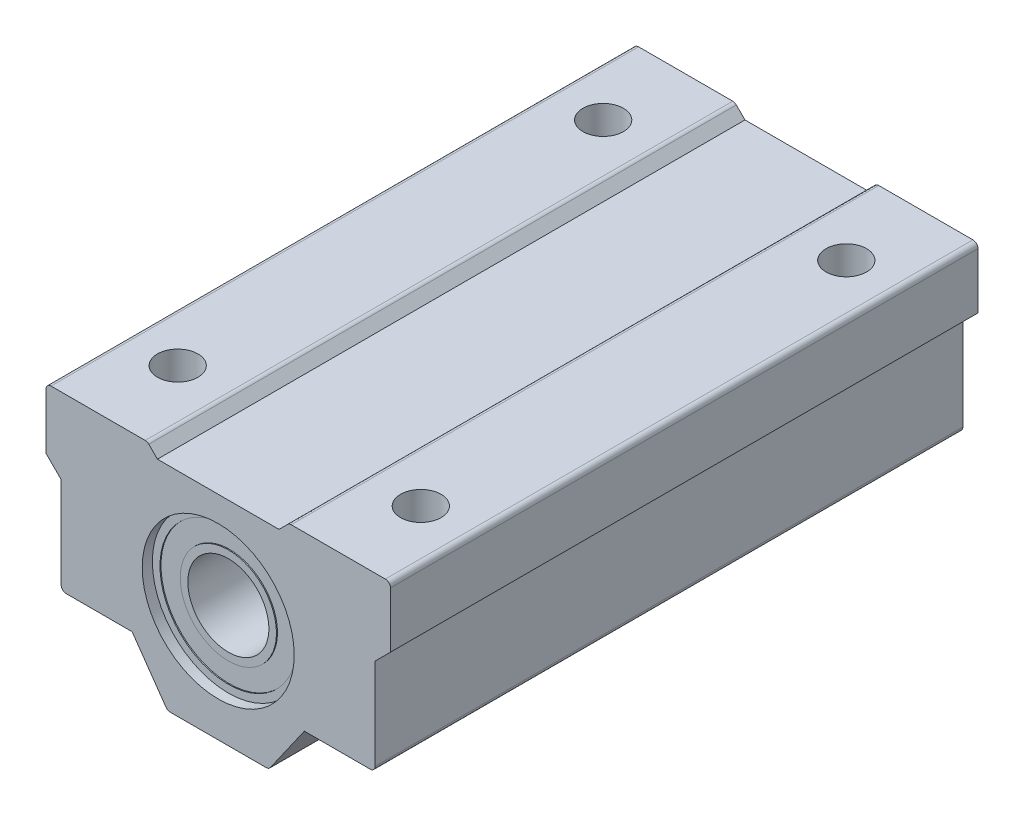
from build123d import *

# Parameters (mm, degrees)
SKETCH1_W           = 31
SKETCH1_H           = 16
BOSS_EXTRUDE1_DEPTH = 58
SKETCH2_W           = 17
SKETCH2_H           = 21
BOSS_EXTRUDE2_DEPTH = 58
SKETCH3_W           = 10
SKETCH3_H           = 6
BOSS_EXTRUDE3_DEPTH = 58
CHAMFER1_SIZE       = 1
CHAMFER2_SIZE       = 1.5
CHAMFER5_SIZE2      = 3.501037691
CHAMFER5_SIZE       = 5
CHAMFER6_SIZE2      = 5
CHAMFER6_SIZE       = 3.501037691
SKETCH4_R           = 7.5
CUT_EXTRUDE1_DEPTH  = 1
CUT_EXTRUDE2_START  = -1
SKETCH5_R           = 7.5
CUT_EXTRUDE2_DEPTH  = 1
SKETCH6_R           = 4
CUT_EXTRUDE3_DEPTH  = 58
SKETCH7_R           = 2
CUT_EXTRUDE4_DEPTH  = 20
SKETCH8_R           = 6.75
SKETCH8_R_2         = 4.75
CUT_EXTRUDE5_DEPTH  = 0.1
CUT_EXTRUDE6_START  = -0.1
SKETCH9_R           = 6.75
SKETCH9_R_2         = 4.75
CUT_EXTRUDE6_DEPTH  = 0.1
FILLET1_R           = 0.5
FILLET2_START       = -1
FILLET2_DEPTH       = 60


with BuildPart() as part:
    # Sketch1 → Boss-Extrude1 (new body)
    with BuildSketch(Plane.XY):
        Rectangle(SKETCH1_W, SKETCH1_H)
    extrude(amount=BOSS_EXTRUDE1_DEPTH)

    # Sketch2 → Boss-Extrude2 (add)
    with BuildSketch(Plane.XY.offset(58)):
        with Locations((0, -2.5)):
            Rectangle(SKETCH2_W, SKETCH2_H)
    extrude(amount=-BOSS_EXTRUDE2_DEPTH)

    # Sketch3 → Boss-Extrude3 (add)
    with BuildSketch(Plane.XY.offset(58)):
        with Locations((-12, 6)):
            Rectangle(SKETCH3_W, SKETCH3_H)
        with Locations((12, 6)):
            Rectangle(SKETCH3_W, SKETCH3_H)
    extrude(amount=-BOSS_EXTRUDE3_DEPTH)

    # Chamfer1
    chamfer1_edges = [part.edges().sort_by_distance(p)[0] for p in [
        (7, 8, 29),
        (-7, 8, 29),
    ]]
    chamfer(chamfer1_edges, length=CHAMFER1_SIZE - 0.0001)  # a hair under: the kernel refuses the full size

    # Chamfer2
    chamfer2_edges = [part.edges().sort_by_distance(p)[0] for p in [
        (15.5, 3, 29),
        (-15.5, 3, 29),
    ]]
    chamfer(chamfer2_edges, length=CHAMFER2_SIZE - 0.0001)  # a hair under: the kernel refuses the full size

    # Chamfer5
    chamfer5_edges = [part.edges().sort_by_distance(p)[0] for p in [
        (-8.5, -13, 29),
    ]]
    chamfer5_side = [part.faces().sort_by_distance(p)[0] for p in [
        (-8.5, -12.929979246, 29),
    ]]
    chamfer(chamfer5_edges, length=CHAMFER5_SIZE - 0.0001, length2=CHAMFER5_SIZE2 - 0.0001, reference=chamfer5_side[0])  # a hair under: the kernel refuses the full size

    # Chamfer6
    chamfer6_edges = [part.edges().sort_by_distance(p)[0] for p in [
        (8.5, -13, 29),
    ]]
    chamfer6_side = [part.faces().sort_by_distance(p)[0] for p in [
        (8.429979246, -13, 29),
    ]]
    chamfer(chamfer6_edges, length=CHAMFER6_SIZE - 0.0001, length2=CHAMFER6_SIZE2 - 0.0001, reference=chamfer6_side[0])  # a hair under: the kernel refuses the full size

    # Sketch4 → Cut-Extrude1 (cut)
    with BuildSketch(Plane.XY.offset(58)):
        with Locations((0, -2)):
            Circle(SKETCH4_R)
    extrude(amount=-CUT_EXTRUDE1_DEPTH, mode=Mode.SUBTRACT)

    # Sketch5 → Cut-Extrude2 (cut)
    with BuildSketch(Plane(origin=(0, 0, 0), x_dir=(-1, 0, 0), z_dir=(0, 0, -1)).offset(CUT_EXTRUDE2_START)):
        with Locations(Location((0, -2, 0), (0, 0, 180))):
            Circle(SKETCH5_R)
    extrude(amount=CUT_EXTRUDE2_DEPTH, mode=Mode.SUBTRACT)

    # Sketch6 → Cut-Extrude3 (cut)
    with BuildSketch(Plane(origin=(0, 0, 1), x_dir=(-1, 0, 0), z_dir=(0, 0, -1))):
        with Locations((0, -2)):
            Circle(SKETCH6_R)
    extrude(amount=-CUT_EXTRUDE3_DEPTH, mode=Mode.SUBTRACT)

    # Sketch7 → Cut-Extrude4 (cut)
    with BuildSketch(Plane(origin=(0, 9, 0), x_dir=(1, 0, 0), z_dir=(0, 1, 0))):
        with Locations(Location((-12, -8, 0), (0, 0, 180))):
            Circle(SKETCH7_R)
        with Locations(Location((12, -8, 0), (0, 0, 180))):
            Circle(SKETCH7_R)
        with Locations(Location((12, -50, 0), (0, 0, 180))):
            Circle(SKETCH7_R)
        with Locations(Location((-12, -50, 0), (0, 0, 180))):
            Circle(SKETCH7_R)
    extrude(amount=-CUT_EXTRUDE4_DEPTH, mode=Mode.SUBTRACT)

    # Sketch8 → Cut-Extrude5 (cut)
    with BuildSketch(Plane.XY.offset(57)):
        with Locations((0, -2)):
            Circle(SKETCH8_R)
        with Locations((0, -2)):
            Circle(SKETCH8_R_2, mode=Mode.SUBTRACT)
    extrude(amount=-CUT_EXTRUDE5_DEPTH, mode=Mode.SUBTRACT)

    # Sketch9 → Cut-Extrude6 (cut)
    with BuildSketch(Plane(origin=(0, 0, 1), x_dir=(-1, 0, 0), z_dir=(0, 0, -1)).offset(CUT_EXTRUDE6_START)):
        with Locations(Location((0, -2, 0), (0, 0, 180))):
            Circle(SKETCH9_R)
        with Locations(Location((0, -2, 0), (0, 0, 180))):
            Circle(SKETCH9_R_2, mode=Mode.SUBTRACT)
    extrude(amount=CUT_EXTRUDE6_DEPTH, mode=Mode.SUBTRACT)

    # Fillet1
    fillet1_edges = [part.edges().sort_by_distance(p)[0] for p in [
        (-4.999062309, -13, 29),
        (4.999062309, -13, 29),
        (-17, 9, 29),
        (17, 9, 29),
        (15.5, -8, 29),
        (-15.5, -8, 29),
    ]]
    fillet(fillet1_edges, radius=FILLET1_R)

    # Fillet2: read off the stored shape, not the designer's step
    # Fillet2 outline → Fillet2 (cut)
    with BuildSketch(Plane.XY.offset(FILLET2_START)):
        with BuildLine():
            Line((7, 9), (6.853553391, 8.853553391))
            ThreePointArc((6.853553391, 8.853553391), (7.015765065, 8.961939766), (7.207106781, 9))
            Line((7.207106781, 9), (7, 9))
        make_face()
        with BuildLine():
            Line((-7, 9), (-7.207106781, 9))
            ThreePointArc((-7.207106781, 9), (-7.015765065, 8.961939766), (-6.853553391, 8.853553391))
            Line((-6.853553391, 8.853553391), (-7, 9))
        make_face()
    extrude(amount=FILLET2_DEPTH, mode=Mode.SUBTRACT)


solid = part.part
